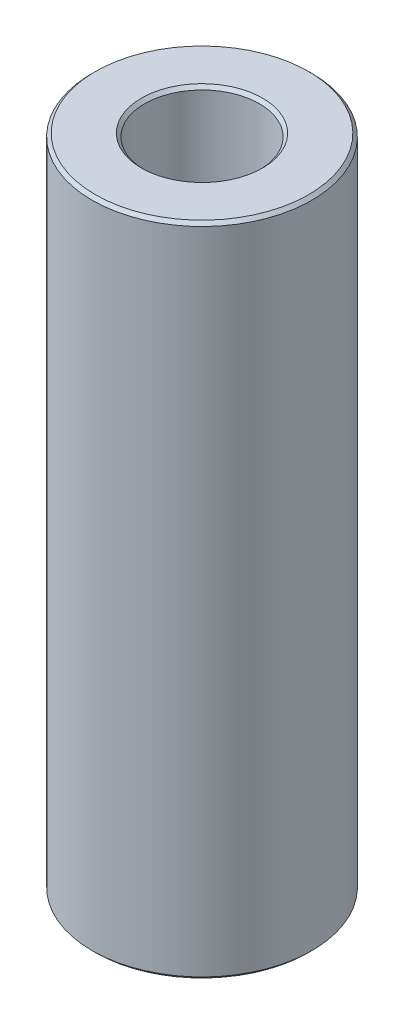
from build123d import *

# Parameters (mm, degrees)
SKETCH1_R           = 37.5
BOSS_EXTRUDE1_DEPTH = 223.973092554
SKETCH2_R           = 19.577024543
CUT_EXTRUDE1_DEPTH  = 231.166127369
CHAMFER1_SIZE       = 1.098728532


with BuildPart() as part:
    # Sketch1 → Boss-Extrude1 (new body)
    with BuildSketch(Plane(origin=(0, 0, 0), x_dir=(1, 0, 0), z_dir=(0, 1, 0))):
        Circle(SKETCH1_R)
    extrude(amount=BOSS_EXTRUDE1_DEPTH)

    # Sketch2 → Cut-Extrude1 (cut, through all)
    with BuildSketch(Plane(origin=(0, 0, 0), x_dir=(1, 0, 0), z_dir=(0, 1, 0))):
        Circle(SKETCH2_R)
    extrude(amount=CUT_EXTRUDE1_DEPTH, mode=Mode.SUBTRACT)

    # Chamfer1
    chamfer1_edges = [part.edges().sort_by_distance(p)[0] for p in [
        (-19.577024543, 223.973092554, 0),
        (-19.577024543, 0, 0),
        (-37.5, 0, 0),
        (-37.5, 223.973092554, 0),
    ]]
    chamfer(chamfer1_edges, length=CHAMFER1_SIZE)


solid = part.part
